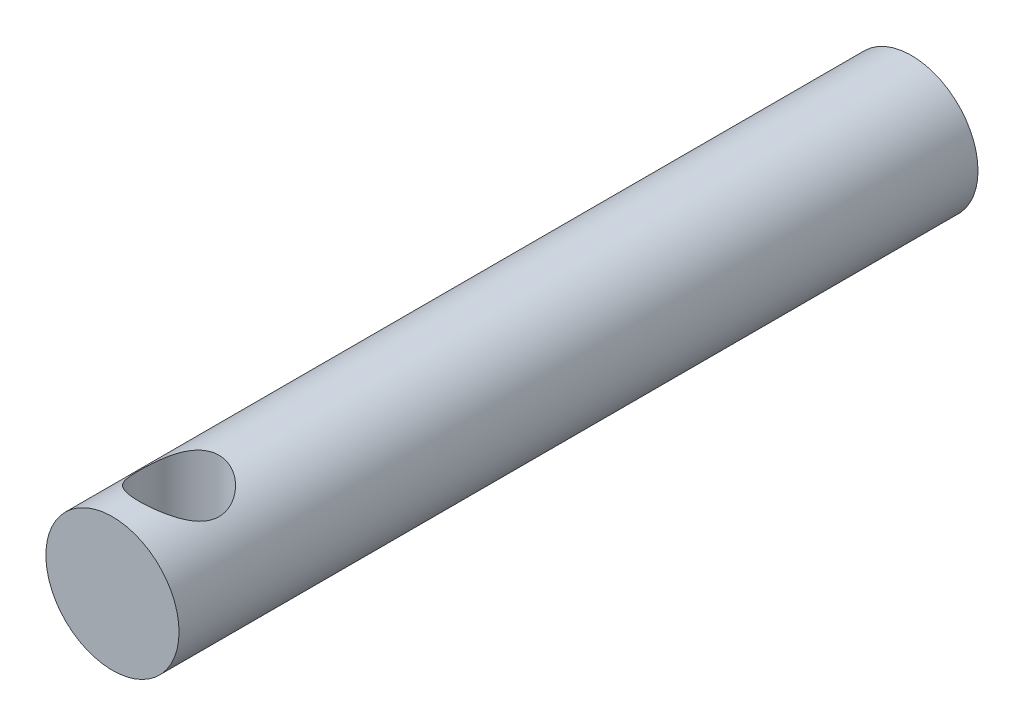
from build123d import *

# Parameters (mm, degrees)
SKETCH1_R               = 2.5
BOSS_EXTRUDE1_DEPTH     = 30
CUT_EXTRUDE1_DEPTH      = 31.207614934
CUT_EXTRUDE1_DEPTH_BACK = 31.207614934
SKETCH2_R               = 1.5


with BuildPart() as part:
    # Sketch1 → Boss-Extrude1 (new body)
    with BuildSketch(Plane.XY):
        Circle(SKETCH1_R)
    extrude(amount=BOSS_EXTRUDE1_DEPTH)

    # Sketch2 → Cut-Extrude1 (cut, two sides: drawn at the far end of the back side and taken through both)
    with BuildSketch(Plane(origin=(0, 0, 0), x_dir=(1, 0, 0), z_dir=(0, 1, 0)).offset(-CUT_EXTRUDE1_DEPTH_BACK)):
        with Locations((0, -27.5)):
            Circle(SKETCH2_R)
    extrude(amount=CUT_EXTRUDE1_DEPTH + CUT_EXTRUDE1_DEPTH_BACK, mode=Mode.SUBTRACT)


solid = part.part
